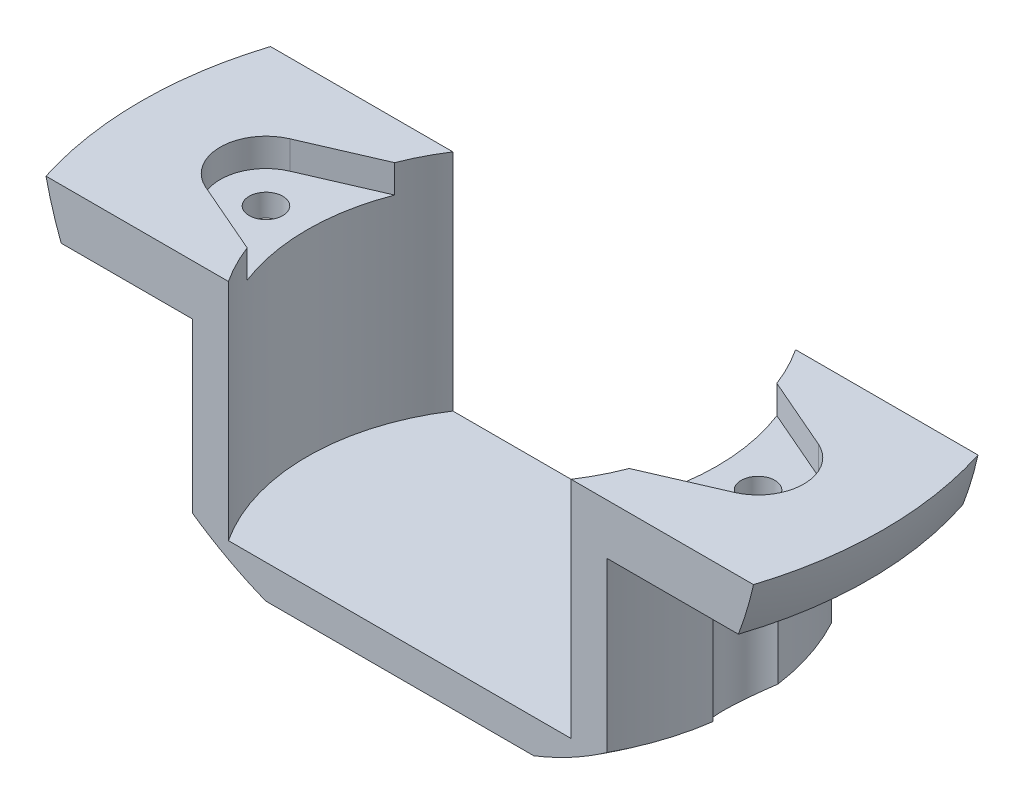
from build123d import *

# Parameters (mm, degrees)
SKETCH2_R               = 33.8
CUT_EXTRUDE1_DEPTH      = 7
SKETCH3_OUTSIDE_W       = 87.592
SKETCH3_OUTSIDE_H       = 87.592
SKETCH3_OUTSIDE_W_2     = 66.134408594
SKETCH3_OUTSIDE_H_2     = 20
CUT_EXTRUDE2_DEPTH      = 54.899165114
CUT_EXTRUDE3_DEPTH      = 2.5
SKETCH6_R               = 18.25
SKETCH6_R_2             = 1.5
CUT_EXTRUDE4_DEPTH      = 17.5
CUT_EXTRUDE5_START      = -19.484712572
CUT_EXTRUDE5_DEPTH      = 14.984712572
CUT_EXTRUDE6_START      = -3
SKETCH8_R               = 33.067204297
CUT_EXTRUDE6_DEPTH      = 37.917915802
CUT_EXTRUDE7_REACH      = 41.188
CUT_EXTRUDE7_END_RADIUS = 33.8
SKETCH9_R               = 3.1


# Read off the part's stored shape, not the designer's step: Cut-Extrude5
with BuildPart() as part:
    # Sketch1 → Revolve1 (revolve)
    with BuildSketch(Plane.XY, mode=Mode.PRIVATE) as revolve1_sk:
        with BuildLine():
            Line((0, -33.8), (0, 0))
            Line((0, 0), (33.8, 0))
            ThreePointArc((33.8, 0), (23.900209204, -23.900209204), (0, -33.8))
        make_face()
    revolve(revolve1_sk.sketch.rotate(Axis((0, -33.8, 0), (0, 1, 0)), 180), axis=Axis((0, -33.8, 0), (0, 1, 0)))

    # Sketch2 → Cut-Extrude1 (cut)
    with BuildSketch(Plane(origin=(0, 0, 0), x_dir=(1, 0, 0), z_dir=(0, 1, 0))):
        Circle(SKETCH2_R)
    extrude(amount=-CUT_EXTRUDE1_DEPTH, mode=Mode.SUBTRACT)

    # Sketch3 outside → Cut-Extrude2 (cut, through all)
    with BuildSketch(Plane(origin=(0, -7, 0), x_dir=(1, 0, 0), z_dir=(0, 1, 0))):
        Rectangle(SKETCH3_OUTSIDE_W, SKETCH3_OUTSIDE_H)
        Rectangle(SKETCH3_OUTSIDE_W_2, SKETCH3_OUTSIDE_H_2, mode=Mode.SUBTRACT)
    extrude(amount=-CUT_EXTRUDE2_DEPTH, mode=Mode.SUBTRACT)

    # Sketch5 → Cut-Extrude3 (cut)
    with BuildSketch(Plane(origin=(0, -7, 0), x_dir=(1, 0, 0), z_dir=(0, 1, 0))):
        with BuildLine():
            Line((-17.025732229, 6.571677263), (-23.544283672, 3.742739979))
            ThreePointArc((-23.544283672, 3.742739979), (-26, 0), (-23.544283672, -3.742739979))
            Line((-23.544283672, -3.742739979), (-17.025732229, -6.571677263))
            ThreePointArc((-17.025732229, -6.571677263), (0, -18.25), (17.025732229, -6.571677263))
            Line((17.025732229, -6.571677263), (23.544283672, -3.742739979))
            ThreePointArc((23.544283672, -3.742739979), (26, 0), (23.544283672, 3.742739979))
            Line((23.544283672, 3.742739979), (17.025732229, 6.571677263))
            ThreePointArc((17.025732229, 6.571677263), (0, 18.25), (-17.025732229, 6.571677263))
        make_face()
    extrude(amount=-CUT_EXTRUDE3_DEPTH, mode=Mode.SUBTRACT)

    # Sketch6 → Cut-Extrude4 (cut)
    with BuildSketch(Plane(origin=(0, -9.5, 0), x_dir=(1, 0, 0), z_dir=(0, 1, 0))):
        Circle(SKETCH6_R)
        with Locations(Location((-21.92, 0, 0), (0, 0, 270))):
            Circle(SKETCH6_R_2)
        with Locations(Location((21.92, 0, 0), (0, 0, 270))):
            Circle(SKETCH6_R_2)
    extrude(amount=-CUT_EXTRUDE4_DEPTH, mode=Mode.SUBTRACT)

    # Cut-Extrude5 outline → Cut-Extrude5 (cut)
    with BuildSketch(Plane(origin=(0, -7, 0), x_dir=(1, 0, 0), z_dir=(0, 1, 0)).offset(CUT_EXTRUDE5_START)):
        with BuildLine():
            ThreePointArc((20.967983577, -1.159165532), (20.206521411, -5.718084686), (18.466185313, -10))
            Line((18.466185313, -10), (33, -10))
            Line((33, -10), (33, 10))
            Line((33, 10), (18.466185313, 10))
            ThreePointArc((18.466185313, 10), (20.206521411, 5.718084686), (20.967983577, 1.159165532))
            ThreePointArc((20.967983577, 1.159165532), (23.42, 0), (20.967983577, -1.159165532))
        make_face()
        with BuildLine():
            ThreePointArc((-18.466185313, -10), (-20.206521411, -5.718084686), (-20.967983577, -1.159165532))
            ThreePointArc((-20.967983577, -1.159165532), (-23.42, 0), (-20.967983577, 1.159165532))
            ThreePointArc((-20.967983577, 1.159165532), (-20.206521411, 5.718084686), (-18.466185313, 10))
            Line((-18.466185313, 10), (-33, 10))
            Line((-33, 10), (-33, -10))
            Line((-33, -10), (-18.466185313, -10))
        make_face()
    extrude(amount=CUT_EXTRUDE5_DEPTH, mode=Mode.SUBTRACT)

    # Sketch8 → Cut-Extrude6 (cut, through all)
    with BuildSketch(Plane(origin=(0, -27, 0), x_dir=(1, 0, 0), z_dir=(0, 1, 0)).offset(CUT_EXTRUDE6_START)):
        Circle(SKETCH8_R)
    extrude(amount=-CUT_EXTRUDE6_DEPTH, mode=Mode.SUBTRACT)

    # Cut-Extrude7: up to this sphere (the profile starts inside it)
    cut_extrude7_end = Location((0, 0, 0)) * Sphere(CUT_EXTRUDE7_END_RADIUS, mode=Mode.PRIVATE)
    # Sketch9 → Cut-Extrude7 (cut, up to the surface)
    with BuildSketch(Plane.XZ.offset(11.5), mode=Mode.PRIVATE) as cut_extrude7_sk1:
        with Locations((-21.92, 0)):
            Circle(SKETCH9_R)
    cut_extrude7_tool1 = extrude(cut_extrude7_sk1.sketch, amount=CUT_EXTRUDE7_REACH, mode=Mode.PRIVATE) & cut_extrude7_end
    add(cut_extrude7_tool1.solids().sort_by_distance((-21.92, -11.5, 0))[0], mode=Mode.SUBTRACT)
    # Sketch9 → Cut-Extrude7 (cut, up to the surface)
    with BuildSketch(Plane.XZ.offset(11.5), mode=Mode.PRIVATE) as cut_extrude7_sk2:
        with Locations((21.92, 0)):
            Circle(SKETCH9_R)
    cut_extrude7_tool2 = extrude(cut_extrude7_sk2.sketch, amount=CUT_EXTRUDE7_REACH, mode=Mode.PRIVATE) & cut_extrude7_end
    add(cut_extrude7_tool2.solids().sort_by_distance((21.92, -11.5, 0))[0], mode=Mode.SUBTRACT)


solid = part.part
